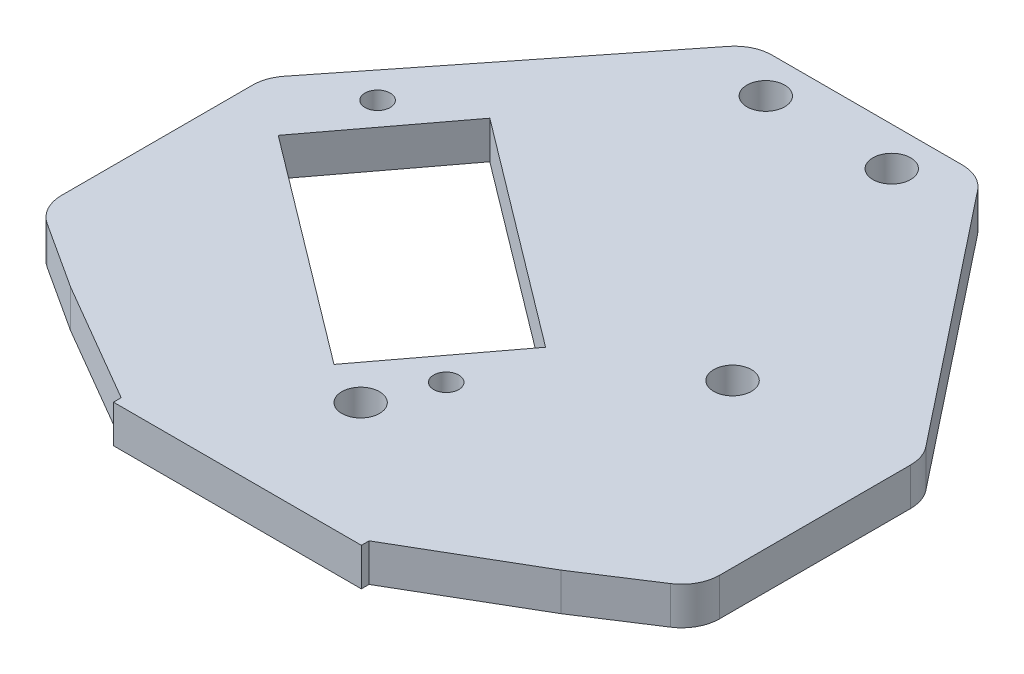
from build123d import *

# Parameters (mm, degrees)
SKETCH1_R               = 1.5
BOSS_EXTRUDE2_DEPTH     = 3
BOSS_EXTRUDE3_DEPTH     = 3
CUT_EXTRUDE2_DEPTH      = 3
SKETCH9_R               = 1
CUT_EXTRUDE3_DEPTH      = 10
SKETCH16_R              = 1.5
CUT_EXTRUDE4_DEPTH      = 10
SKETCH19_R              = 1.5
CUT_EXTRUDE6_DEPTH      = 10
SKETCH18_R              = 3.5
BOSS_EXTRUDE4_DEPTH     = 20
SKETCH20_R              = 1.5
CUT_EXTRUDE7_DEPTH      = 12
CUT_EXTRUDE8_DEPTH      = 91.542969379
CUT_EXTRUDE8_DEPTH_BACK = 91.542969379
SKETCH21_W              = 39.350003638
SKETCH21_H              = 17.954063997
SKETCH21_W_2            = 19.805028886
SKETCH21_H_2            = 5.449762841
CUT_EXTRUDE9_DEPTH      = 54.196430775
CUT_EXTRUDE9_DEPTH_BACK = 54.196430775
SKETCH22_W              = 4.170899172
SKETCH22_H              = 35.336089083
SKETCH22_W_2            = 4.903181497
SKETCH22_H_2            = 36.711591939


with BuildPart() as part:
    # Sketch1 → Boss-Extrude2 (new body)
    with BuildSketch(Plane(origin=(0, 0, 0), x_dir=(1, 0, 0), z_dir=(0, 1, 0))):
        with BuildLine():
            Line((4.159514314, 37.595121312), (-4.159514314, 37.595121312))
            Line((-4.159514314, 37.595121312), (-7.549882818, 37.595121312))
            ThreePointArc((-7.549882818, 37.595121312), (-8.856700821, 37.295533634), (-9.902514443, 36.456605784))
            Line((-9.902514443, 36.456605784), (-18.853635092, 25.143758516))
            Line((-18.853635092, 25.143758516), (-20.315716636, 23.295911096))
            Line((-20.315716636, 23.295911096), (-25.482524908, 16.765855795))
            ThreePointArc((-25.482524908, 16.765855795), (-25.963433019, 15.889791317), (-26.129893283, 14.904371323))
            Line((-26.129893283, 14.904371323), (-26.129893283, -0.264323136))
            ThreePointArc((-26.129893283, -0.264323136), (-25.765831749, -1.696743606), (-24.76200768, -2.781504614))
            Line((-24.76200768, -2.781504614), (-19.713739782, -6.054749228))
            Line((-19.713739782, -6.054749228), (-19.472922353, -6.210892754))
            Line((-19.472922353, -6.210892754), (-9.845245803, -11.818200299))
            Line((-9.845245803, -11.818200299), (-9.845245803, -21.818200299))
            Line((-9.845245803, -21.818200299), (-6.845245803, -21.818200299))
            Line((-6.845245803, -21.818200299), (-6.845245803, -12.43052246))
            Line((-6.845245803, -12.43052246), (6.845245803, -12.43052246))
            Line((6.845245803, -12.43052246), (6.845245803, -21.818200299))
            Line((6.845245803, -21.818200299), (9.845245803, -21.818200299))
            Line((9.845245803, -21.818200299), (9.845245803, -11.818200299))
            Line((9.845245803, -11.818200299), (19.472922353, -6.210892754))
            Line((19.472922353, -6.210892754), (19.713739782, -6.054749228))
            Line((19.713739782, -6.054749228), (24.76200768, -2.781504614))
            ThreePointArc((24.76200768, -2.781504614), (25.765831749, -1.696743606), (26.129893283, -0.264323136))
            Line((26.129893283, -0.264323136), (26.129893283, 14.904371323))
            ThreePointArc((26.129893283, 14.904371323), (25.963433019, 15.889791317), (25.482524908, 16.765855795))
            Line((25.482524908, 16.765855795), (20.315716636, 23.295911096))
            Line((20.315716636, 23.295911096), (18.853635092, 25.143758516))
            Line((18.853635092, 25.143758516), (9.902514443, 36.456605784))
            ThreePointArc((9.902514443, 36.456605784), (8.856700821, 37.295533634), (7.549882818, 37.595121312))
            Line((7.549882818, 37.595121312), (4.159514314, 37.595121312))
        make_face()
        with Locations((-5.001681115, 34.535904251)):
            Circle(SKETCH1_R, mode=Mode.SUBTRACT)
        with Locations((5.001681115, 34.535904251)):
            Circle(SKETCH1_R, mode=Mode.SUBTRACT)
    boss_extrude2 = extrude(amount=BOSS_EXTRUDE2_DEPTH)

    # Mirror1: Boss-Extrude2 across plane
    add(boss_extrude2.mirror(Plane(origin=(0, 0, 0), x_dir=(0, 0, 1), z_dir=(1, 0, 0))))

    # Sketch3 → Boss-Extrude3 (add)
    with BuildSketch(Plane(origin=(9.845245803, 0, 0), x_dir=(0, 0, -1), z_dir=(1, 0, 0))):
        with BuildLine():
            Line((0, 0), (-5.421352116, -2.066157894))
            ThreePointArc((-5.421352116, -2.066157894), (-7.850185569, -2.74644586), (-10.362047471, -2.975734863))
            Line((-10.362047471, -2.975734863), (-38.362047471, -2.975734863))
            ThreePointArc((-38.362047471, -2.975734863), (-41.134396036, -2.468883109), (-43.548074422, -1.013901351))
            ThreePointArc((-43.548074422, -1.013901351), (-45.923317218, 2.205664871), (-46.764673565, 6.117122974))
            Line((-46.764673565, 6.117122974), (-46.764673565, 8.824758711))
            ThreePointArc((-46.764673565, 8.824758711), (-43.812873151, 15.930413437), (-36.754866074, 18.994396283))
            Line((-36.754866074, 18.994396283), (-26.754866074, 18.994396283))
            ThreePointArc((-26.754866074, 18.994396283), (-19.981920665, 17.598328696), (-14.313116387, 13.637716084))
            Line((-14.313116387, 13.637716084), (-3.618521022, 3))
            Line((-3.618521022, 3), (0, 0))
        make_face()
    boss_extrude3 = extrude(amount=-BOSS_EXTRUDE3_DEPTH)

    # Mirror2: Boss-Extrude3 across plane
    add(boss_extrude3.mirror(Plane(origin=(0, 0, 0), x_dir=(0, 0, 1), z_dir=(1, 0, 0))))

    # Sketch5 → Cut-Extrude2 (cut)
    with BuildSketch(Plane.ZY.offset(9.845245803)):
        with BuildLine():
            Line((26.104098684, 8.568437952), (14.348200299, 8.568437952))
            ThreePointArc((14.348200299, 8.568437952), (13.848200299, 8.068437952), (14.348200299, 7.568437952))
            Line((14.348200299, 7.568437952), (26.104098684, 7.568437952))
            ThreePointArc((26.104098684, 7.568437952), (27.093326565, 5.593564218), (29.068200299, 4.604336337))
            Line((29.068200299, 4.604336337), (29.068200299, 1.213437952))
            ThreePointArc((29.068200299, 1.213437952), (29.568200299, 0.713437952), (30.068200299, 1.213437952))
            Line((30.068200299, 1.213437952), (30.068200299, 4.604336337))
            ThreePointArc((30.068200299, 4.604336337), (32.043074033, 5.593564218), (33.032301914, 7.568437952))
            Line((33.032301914, 7.568437952), (44.788200299, 7.568437952))
            ThreePointArc((44.788200299, 7.568437952), (45.288200299, 8.068437952), (44.788200299, 8.568437952))
            Line((44.788200299, 8.568437952), (33.032301914, 8.568437952))
            ThreePointArc((33.032301914, 8.568437952), (32.043074033, 10.543311686), (30.068200299, 11.532539567))
            Line((30.068200299, 11.532539567), (30.068200299, 14.923437952))
            ThreePointArc((30.068200299, 14.923437952), (29.568200299, 15.423437952), (29.068200299, 14.923437952))
            Line((29.068200299, 14.923437952), (29.068200299, 11.532539567))
            ThreePointArc((29.068200299, 11.532539567), (27.093326565, 10.543311686), (26.104098684, 8.568437952))
        make_face()
    extrude(amount=-CUT_EXTRUDE2_DEPTH, mode=Mode.SUBTRACT)

    # Sketch9 → Cut-Extrude3 (cut)
    with BuildSketch(Plane(origin=(0, 3, 0), x_dir=(1, 0, 0), z_dir=(0, 1, 0))):
        Polygon((-3.685085338, -1.07663963), (3.53669494, 8.50698649), (-14.432604036, 22.047824511), (-21.654384314, 12.464198391), align=None)
        with Locations((2.002257127, 2.15045437)):
            Circle(SKETCH9_R)
        with Locations((-20.119946501, 18.820730511)):
            Circle(SKETCH9_R)
    extrude(amount=-CUT_EXTRUDE3_DEPTH, mode=Mode.SUBTRACT)

    # Sketch16 → Cut-Extrude4 (cut)
    with BuildSketch(Plane(origin=(0, 3, 0), x_dir=(1, 0, 0), z_dir=(0, 1, 0))):
        with Locations((13.251681115, 13.645904251)):
            Circle(SKETCH16_R)
    extrude(amount=-CUT_EXTRUDE4_DEPTH, mode=Mode.SUBTRACT)

    # Sketch19 → Cut-Extrude6 (cut)
    with BuildSketch(Plane(origin=(0, 3, 0), x_dir=(1, 0, 0), z_dir=(0, 1, 0))):
        with Locations((0, -2.642994386)):
            Circle(SKETCH19_R)
    extrude(amount=-CUT_EXTRUDE6_DEPTH, mode=Mode.SUBTRACT)

    # Sketch18 → Boss-Extrude4 (add)
    with BuildSketch(Plane.ZY.offset(-6.845245803)):
        with Locations((29.568200299, 8.068437952)):
            Circle(SKETCH18_R)
    extrude(amount=-BOSS_EXTRUDE4_DEPTH)

    # Sketch20 → Cut-Extrude7 (cut)
    with BuildSketch(Plane(origin=(26.845245803, 0, 0), x_dir=(0, 0, -1), z_dir=(1, 0, 0))):
        with Locations((-29.568200299, 8.068437952)):
            Circle(SKETCH20_R)
    extrude(amount=-CUT_EXTRUDE7_DEPTH, mode=Mode.SUBTRACT)

    # Sketch21 → Cut-Extrude8 (cut, two sides: drawn at the far end of the back side and taken through both)
    with BuildSketch(Plane(origin=(0, 0, -37.595121312), x_dir=(-1, 0, 0), z_dir=(0, 0, -1)).offset(-CUT_EXTRUDE8_DEPTH_BACK)):
        with Locations((-9.829756016, 11.977031999)):
            Rectangle(SKETCH21_W, SKETCH21_H)
        with Locations((0, -2.724881421)):
            Rectangle(SKETCH21_W_2, SKETCH21_H_2)
    extrude(amount=CUT_EXTRUDE8_DEPTH + CUT_EXTRUDE8_DEPTH_BACK, mode=Mode.SUBTRACT)

    # Sketch22 → Cut-Extrude9 (cut, two sides: drawn at the far end of the back side and taken through both)
    with BuildSketch(Plane(origin=(0, 3, 0), x_dir=(1, 0, 0), z_dir=(0, 1, 0)).offset(-CUT_EXTRUDE9_DEPTH_BACK)):
        with Locations((8.930695389, -30.098567002)):
            Rectangle(SKETCH22_W, SKETCH22_H)
        with Locations((-9.296836552, -30.786318429)):
            Rectangle(SKETCH22_W_2, SKETCH22_H_2)
    extrude(amount=CUT_EXTRUDE9_DEPTH + CUT_EXTRUDE9_DEPTH_BACK, mode=Mode.SUBTRACT)


solid = part.part
